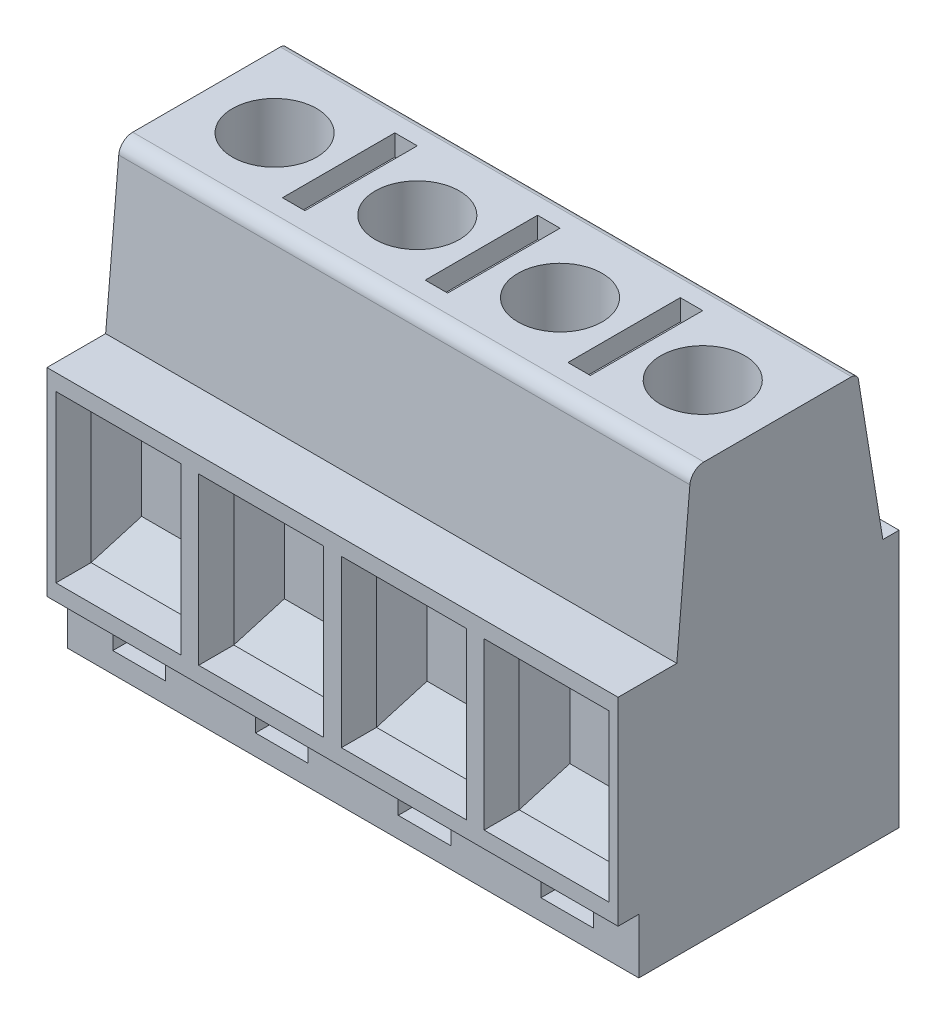
from build123d import *

# Parameters (mm, degrees)
BOSS_EXTRUDE1_DEPTH     = 10.16
SKETCH2_W               = 8.900000000000002
SKETCH2_H               = 11.800000000000011
CUT_EXTRUDE1_DEPTH      = 2.5
SKETCH5_R               = 2.9999999999999996
CUT_EXTRUDE2_DEPTH      = 5.7
SKETCH7_W               = 1.2999999999999998
SKETCH7_H               = 0.8000000000000007
SKETCH7_H_2             = 0.7999999999999936
BOSS_EXTRUDE2_DEPTH     = 4.5
CUT_EXTRUDE5_START      = -10.96
CUT_EXTRUDE5_DEPTH      = 10.96
SKETCH10_R              = 1.4999999999999998
CUT_EXTRUDE6_DEPTH      = 4.5
SKETCH13_W              = 3.75
SKETCH13_H              = 1
CUT_EXTRUDE8_DEPTH      = 3
FILLET3_R               = 0.5
FILLET4_R               = 1
SKETCH12_W              = 1.2999999999999998
SKETCH12_H              = 1.299999999999999
BOSS_EXTRUDE3_DEPTH     = 0.5
BOSS_EXTRUDE3_2_DEPTH   = 0.5
BOSS_EXTRUDE3_3_DEPTH   = 0.5
BOSS_EXTRUDE4_START     = 0.01
BOSS_EXTRUDE4_DEPTH     = 0.01
LPATTERN8_COUNT         = 4
LPATTERN8_PITCH         = 10.16
LPATTERN8_2_COUNT       = 4
LPATTERN8_2_PITCH       = 10.16
LPATTERN8_3_COUNT       = 4
LPATTERN8_3_PITCH       = 10.16
LPATTERN8_4_COUNT       = 4
LPATTERN8_4_PITCH       = 10.16
FILLET3_OF_LPATTERN8_R  = 0.5
FILLET4_OF_LPATTERN8_R  = 1
SKETCH11_W              = 1.6
SKETCH11_H              = 8
CUT_EXTRUDE7_DEPTH      = 1.5
LPATTERN9_START         = 57.041856165
LPATTERN9_OUTLINE_W     = 1.6000000000000014
LPATTERN9_OUTLINE_H     = 8
LPATTERN9_DEPTH         = 1.5
LPATTERN9_START_2       = 28.541856165
LPATTERN9_2_OUTLINE_W   = 1.2999999999999972
LPATTERN9_2_OUTLINE_H   = 1.299999999999999
LPATTERN9_2_OUTLINE_W_2 = 1.3000000000000007
LPATTERN9_2_OUTLINE_H_2 = 1.2999999999999972
LPATTERN9_2_OUTLINE_H_3 = 1.3000000000000007
LPATTERN9_2_DEPTH       = 0.5
BOSS_EXTRUDE6_DEPTH     = 0.01


# Read off the part's stored shape, not the designer's step: Cut-Extrude5, LPattern9
with BuildPart() as part:
    # Sketch1 → Boss-Extrude1 (new body)
    with BuildSketch(Plane(origin=(0, 0, 0), x_dir=(0, 0, -1), z_dir=(1, 0, 0))):
        Polygon((9.669213470381848, 32.96915259715871), (9.669213470381848, 47.08678337249189), (13.847501539912686, 47.08678337249189), (14.859335014289963, 58.54185616450892), (26.70903057031256, 58.54185616450892), (28.514863984729242, 47.38649061080074), (29.669213470381848, 47.38649061080074), (29.66921347038185, 29.041856164508925), (11.142277404209432, 29.04185616450892), (11.142277404209432, 32.96915259715871), align=None)
    boss_extrude1 = extrude(amount=BOSS_EXTRUDE1_DEPTH)

    # Sketch2 → Cut-Extrude1 (cut)
    with BuildSketch(Plane.XY.offset(-9.669213470381848)):
        with Locations((5.08, 40.0279679848253)):
            Rectangle(SKETCH2_W, SKETCH2_H)
    cut_extrude1 = extrude(amount=-CUT_EXTRUDE1_DEPTH, mode=Mode.SUBTRACT)

    # Sketch3 → Cut-Loft1 section 0
    with BuildSketch(Plane.XY.offset(-12.169213470381848)):
        with BuildLine():
            Line((9.530000000000001, 34.1279679848253), (9.530000000000001, 45.92796798482531))
            Line((9.530000000000001, 45.92796798482531), (0.6299999999999994, 45.92796798482531))
            Line((0.6299999999999994, 45.92796798482531), (0.6299999999999994, 34.1279679848253))
            Line((0.6299999999999994, 34.1279679848253), (9.530000000000001, 34.1279679848253))
        make_face()
    # Sketch4 → Cut-Loft1 section 1
    with BuildSketch(Plane.XY.offset(-14.069213470381849)):
        with BuildLine():
            Line((2.3299999999999987, 36.877967984825304), (7.829999999999998, 36.877967984825304))
            Line((7.829999999999998, 36.877967984825304), (7.829999999999998, 43.1779679848253))
            Line((7.829999999999998, 43.1779679848253), (2.3299999999999987, 43.1779679848253))
            Line((2.3299999999999987, 43.1779679848253), (2.3299999999999987, 36.877967984825304))
        make_face()
    cut_loft1 = loft(mode=Mode.SUBTRACT)

    # Sketch5 → Cut-Extrude2 (cut)
    with BuildSketch(Plane(origin=(0, 58.54185616450892, 0), x_dir=(1, 0, 0), z_dir=(0, 1, 0))):
        with Locations(Location((5.08, 20.784182792301262, 0), (0, 0, 270))):
            Circle(SKETCH5_R)
    cut_extrude2 = extrude(amount=-CUT_EXTRUDE2_DEPTH, mode=Mode.SUBTRACT)

    # Sketch7 → Boss-Extrude2 (add)
    with BuildSketch(Plane.XZ.offset(-29.041856164508918)):
        with Locations((5.08, -27.169213470381862)):
            Rectangle(SKETCH7_W, SKETCH7_H)
        with Locations((5.08, -17.00921347038186)):
            Rectangle(SKETCH7_W, SKETCH7_H_2)
    boss_extrude2 = extrude(amount=BOSS_EXTRUDE2_DEPTH)

    # Cut-Extrude5 outline → Cut-Extrude5 (cut)
    with BuildSketch(Plane.XY.offset(-16.60921347038186).offset(CUT_EXTRUDE5_START)):
        with BuildLine():
            Line((5.73, 24.541856165), (5.73, 25.191856165))
            ThreePointArc((5.73, 25.191856165), (5.539619408, 24.732236757), (5.08, 24.541856165))
            Line((5.08, 24.541856165), (5.73, 24.541856165))
        make_face()
        with BuildLine():
            Line((4.43, 24.541856165), (5.08, 24.541856165))
            ThreePointArc((5.08, 24.541856165), (4.620380592, 24.732236757), (4.43, 25.191856165))
            Line((4.43, 25.191856165), (4.43, 24.541856165))
        make_face()
    cut_extrude5 = extrude(amount=CUT_EXTRUDE5_DEPTH, mode=Mode.SUBTRACT)

    # Sketch10 → Cut-Extrude6 (cut)
    with BuildSketch(Plane(origin=(0, 38.527852040591384, -38.527852040591256), x_dir=(-1, 0, 0), z_dir=(0, 0.7071067811865488, -0.7071067811865464))):
        with Locations(Location((-5.08, 12.528006810151506, 0), (0, 0, 90))):
            Circle(SKETCH10_R)
    cut_extrude6 = extrude(amount=-CUT_EXTRUDE6_DEPTH, mode=Mode.SUBTRACT)

    # Sketch13 → Cut-Extrude8 (cut)
    with BuildSketch(Plane.XY.offset(-11.142277404209432)):
        with Locations((5.080000000000007, 31.005504380833823)):
            Rectangle(SKETCH13_W, SKETCH13_H)
    cut_extrude8 = extrude(amount=-CUT_EXTRUDE8_DEPTH, mode=Mode.SUBTRACT)

    # Fillet3
    fillet3_edges = [part.edges().sort_by_distance(p)[0] for p in [
        (5.08, 58.54185616450892, -26.70903057031256),
    ]]
    fillet(fillet3_edges, radius=FILLET3_R)

    # Fillet4
    fillet4_edges = [part.edges().sort_by_distance(p)[0] for p in [
        (5.08, 58.54185616450892, -14.859335014289963),
    ]]
    fillet(fillet4_edges, radius=FILLET4_R)

    # Sketch14 → Boss-Extrude4 (add)
    with BuildSketch(Plane(origin=(10.16, 0, 0), x_dir=(0, 0, -1), z_dir=(1, 0, 0)).offset(BOSS_EXTRUDE4_START)):
        with BuildLine():
            Line((14.77877644669124, 57.629844179105966), (13.847501539912686, 47.08678337249189))
            Line((13.847501539912686, 47.08678337249189), (9.669213470381848, 47.08678337249189))
            Line((9.669213470381848, 47.08678337249189), (9.669213470381848, 32.96915259715871))
            Line((9.669213470381848, 32.96915259715871), (11.142277404209432, 32.96915259715871))
            Line((11.142277404209432, 32.96915259715871), (11.142277404209432, 29.04185616450892))
            Line((11.142277404209432, 29.04185616450892), (29.66921347038185, 29.041856164508925))
            Line((29.66921347038185, 29.041856164508925), (29.669213470381848, 47.38649061080074))
            Line((29.669213470381848, 47.38649061080074), (28.514863984729242, 47.38649061080074))
            Line((28.514863984729242, 47.38649061080074), (26.777036465378647, 58.121756163471794))
            ThreePointArc((26.777036465378647, 58.121756163471794), (26.607537368480997, 58.42261199143836), (26.28346175961899, 58.54185616450892))
            Line((26.28346175961899, 58.54185616450892), (15.77489798008326, 58.54185616450892))
            ThreePointArc((15.77489798008326, 58.54185616450892), (15.09961582223998, 58.279415658582806), (14.77877644669124, 57.629844179105966))
        make_face()
    extrude(amount=-BOSS_EXTRUDE4_DEPTH)



with BuildPart() as body_2:
    # Sketch12 → Boss-Extrude3 (new body)
    with BuildSketch(Plane.XZ.offset(-29.041856164508918)):
        with Locations((3.9e-16, -15.192277404209438)):
            Rectangle(SKETCH12_W, SKETCH12_H)
    extrude(amount=BOSS_EXTRUDE3_DEPTH)


with BuildPart() as body_3:
    # Sketch12 → Boss-Extrude3 2 (new body)
    with BuildSketch(Plane.XZ.offset(-29.041856164508918)):
        Polygon((-0.6500000000000012, -20.342277404209444), (0.6499999999999989, -20.342277404209444), (0.649999999999998, -19.04227740420944), (-0.6500000000000012, -19.04227740420944), align=None)
    extrude(amount=BOSS_EXTRUDE3_2_DEPTH)


with BuildPart() as body_4:
    # Sketch12 → Boss-Extrude3 3 (new body)
    with BuildSketch(Plane.XZ.offset(-29.041856164508918)):
        Polygon((-0.6499999999999996, -25.042277404209447), (0.6500000000000006, -25.042277404209447), (0.6500000000000008, -23.742277404209442), (-0.6499999999999996, -23.742277404209442), align=None)
    extrude(amount=BOSS_EXTRUDE3_3_DEPTH)


with BuildPart() as part_1:
    add(part.part)

    add(body_2.part)  # LPattern8 merges body 2

    add(body_3.part)  # LPattern8 merges body 3

    add(body_4.part)  # LPattern8 merges body 4
    # LPattern8: Boss-Extrude1 ×4
    with Locations(*[(-i * LPATTERN8_PITCH, 0, 0) for i in range(1, LPATTERN8_COUNT)]):
        add(boss_extrude1)

    # LPattern8 2: Cut-Extrude1, Cut-Loft1, Cut-Extrude2 ×4
    with Locations(*[(-i * LPATTERN8_2_PITCH, 0, 0) for i in range(1, LPATTERN8_2_COUNT)]):
        add(cut_extrude1, mode=Mode.SUBTRACT)
        add(cut_loft1, mode=Mode.SUBTRACT)
        add(cut_extrude2, mode=Mode.SUBTRACT)

    # LPattern8 3: Boss-Extrude2 ×4
    with Locations(*[(-i * LPATTERN8_3_PITCH, 0, 0) for i in range(1, LPATTERN8_3_COUNT)]):
        add(boss_extrude2)

    # LPattern8 4: Cut-Extrude5, Cut-Extrude6, Cut-Extrude8 ×4
    with Locations(*[(-i * LPATTERN8_4_PITCH, 0, 0) for i in range(1, LPATTERN8_4_COUNT)]):
        add(cut_extrude5, mode=Mode.SUBTRACT)
        add(cut_extrude6, mode=Mode.SUBTRACT)
        add(cut_extrude8, mode=Mode.SUBTRACT)

    # Fillet3 of LPattern8
    fillet3_of_lpattern8_edges = [part_1.edges().sort_by_distance(p)[0] for p in [
        (-5.08, 58.54185616450892, -26.70903057031256),
        (-15.24, 58.54185616450892, -26.70903057031256),
        (-25.4, 58.54185616450892, -26.70903057031256),
    ]]
    fillet(fillet3_of_lpattern8_edges, radius=FILLET3_OF_LPATTERN8_R)

    # Fillet4 of LPattern8
    fillet4_of_lpattern8_edges = [part_1.edges().sort_by_distance(p)[0] for p in [
        (-5.08, 58.54185616450892, -14.859335014289963),
        (-15.24, 58.54185616450892, -14.859335014289963),
        (-25.4, 58.54185616450892, -14.859335014289963),
    ]]
    fillet(fillet4_of_lpattern8_edges, radius=FILLET4_OF_LPATTERN8_R)

    # Sketch11 → Cut-Extrude7 (cut)
    with BuildSketch(Plane(origin=(0, 58.54185616450892, 0), x_dir=(1, 0, 0), z_dir=(0, 1, 0))):
        with Locations((4.16e-15, 21.064117563348077)):
            Rectangle(SKETCH11_W, SKETCH11_H)
    extrude(amount=-CUT_EXTRUDE7_DEPTH, mode=Mode.SUBTRACT)

    # LPattern9 outline → LPattern9 (cut)
    with BuildSketch(Plane(origin=(0, 0, 0), x_dir=(1, 0, 0), z_dir=(0, 1, 0)).offset(LPATTERN9_START)):
        with Locations((-20.32, 21.064117563)):
            Rectangle(LPATTERN9_OUTLINE_W, LPATTERN9_OUTLINE_H)
        with Locations((-10.16, 21.064117563)):
            Rectangle(LPATTERN9_OUTLINE_W, LPATTERN9_OUTLINE_H)
    extrude(amount=LPATTERN9_DEPTH, mode=Mode.SUBTRACT)

    # LPattern9 2 outline → LPattern9 2 (add)
    with BuildSketch(Plane(origin=(0, 0, 0), x_dir=(1, 0, 0), z_dir=(0, 1, 0)).offset(LPATTERN9_START_2)):
        with Locations((-20.32, 15.192277404000002)):
            Rectangle(LPATTERN9_2_OUTLINE_W, LPATTERN9_2_OUTLINE_H)
        with Locations((-10.16, 15.192277404000002)):
            Rectangle(LPATTERN9_2_OUTLINE_W_2, LPATTERN9_2_OUTLINE_H)
        with Locations((-20.32, 24.392277404)):
            Rectangle(LPATTERN9_2_OUTLINE_W, LPATTERN9_2_OUTLINE_H_2)
        with Locations((-20.32, 19.692277404000002)):
            Rectangle(LPATTERN9_2_OUTLINE_W, LPATTERN9_2_OUTLINE_H_3)
        with Locations((-10.16, 24.392277404)):
            Rectangle(LPATTERN9_2_OUTLINE_W_2, LPATTERN9_2_OUTLINE_H_2)
        with Locations((-10.16, 19.692277404000002)):
            Rectangle(LPATTERN9_2_OUTLINE_W_2, LPATTERN9_2_OUTLINE_H_3)
    extrude(amount=LPATTERN9_2_DEPTH)

    # Sketch16 → Boss-Extrude6 (add)
    with BuildSketch(Plane.ZY.offset(30.48)):
        with BuildLine():
            Line((-13.847501539912686, 47.08678337249189), (-14.77877644669124, 57.629844179105966))
            ThreePointArc((-14.77877644669124, 57.629844179105966), (-15.09961582223998, 58.279415658582806), (-15.77489798008326, 58.54185616450892))
            Line((-15.77489798008326, 58.54185616450892), (-26.28346175961899, 58.54185616450892))
            ThreePointArc((-26.28346175961899, 58.54185616450892), (-26.607537368480997, 58.42261199143836), (-26.777036465378647, 58.121756163471794))
            Line((-26.777036465378647, 58.121756163471794), (-28.514863984729242, 47.38649061080074))
            Line((-28.514863984729242, 47.38649061080074), (-29.669213470381848, 47.38649061080074))
            Line((-29.669213470381848, 47.38649061080074), (-29.66921347038185, 29.041856164508925))
            Line((-29.66921347038185, 29.041856164508925), (-11.142277404209432, 29.04185616450892))
            Line((-11.142277404209432, 29.04185616450892), (-11.142277404209432, 32.96915259715871))
            Line((-11.142277404209432, 32.96915259715871), (-9.669213470381848, 32.96915259715871))
            Line((-9.669213470381848, 32.96915259715871), (-9.669213470381848, 47.08678337249189))
            Line((-9.669213470381848, 47.08678337249189), (-13.847501539912686, 47.08678337249189))
        make_face()
    extrude(amount=BOSS_EXTRUDE6_DEPTH)


solid = part_1.part
